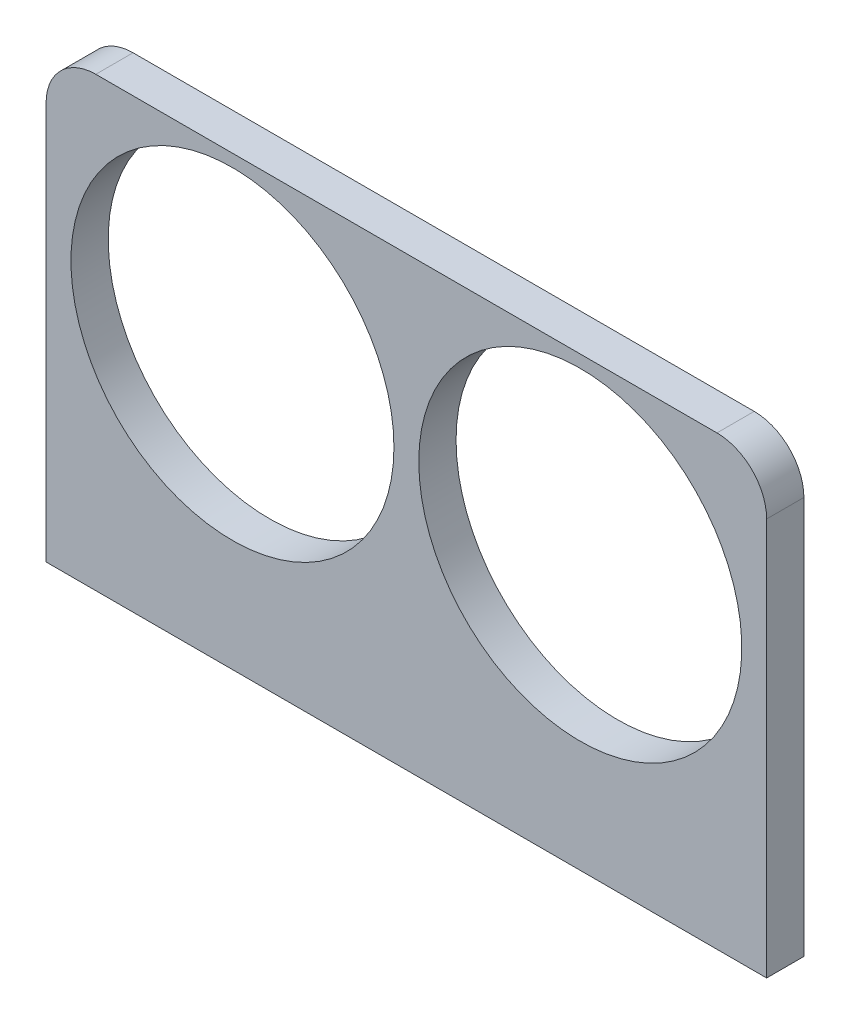
from build123d import *

# Parameters (mm, degrees)
SKETCH1_W           = 29
SKETCH1_H           = 18
SKETCH1_R           = 6.5
BOSS_EXTRUDE1_DEPTH = 1.5
FILLET1_R           = 2


with BuildPart() as part:
    # Sketch1 → Boss-Extrude1 (new body)
    with BuildSketch(Plane.XY):
        with Locations((14.5, 9)):
            Rectangle(SKETCH1_W, SKETCH1_H)
        with Locations((7.5, 11)):
            Circle(SKETCH1_R, mode=Mode.SUBTRACT)
        with Locations((21.5, 11)):
            Circle(SKETCH1_R, mode=Mode.SUBTRACT)
    extrude(amount=BOSS_EXTRUDE1_DEPTH)

    # Fillet1
    fillet1_edges = [part.edges().sort_by_distance(p)[0] for p in [
        (29, 18, 0.75),
        (0, 18, 0.75),
    ]]
    fillet(fillet1_edges, radius=FILLET1_R)


solid = part.part
